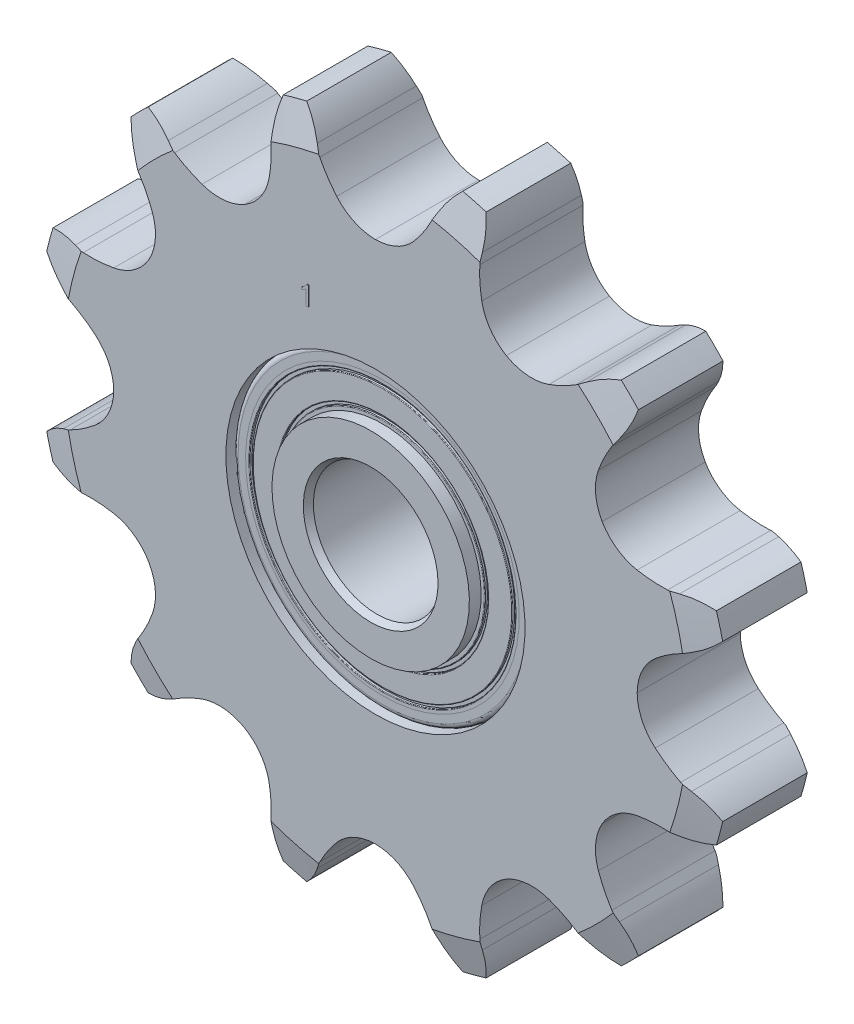
from build123d import *

# Parameters (mm, degrees)
SKETCH3_W               = 16.2
SKETCH3_H               = 31
CUT_EXTRUDE1_DEPTH      = 78.499096769
CIRPATTERN1_COUNT       = 12
SKETCH5_OUTSIDE_W       = 719.348
SKETCH5_OUTSIDE_H       = 719.348
SKETCH5_OUTSIDE_R       = 49.069031975
CUT_EXTRUDE2_DEPTH      = 77.828852413
CUT_EXTRUDE2_DRAFT      = -75
MIRROR1_COPY_1_SKETCH_W = 719.348
MIRROR1_COPY_1_SKETCH_H = 719.348
MIRROR1_COPY_1_SKETCH_R = 49.069031975
MIRROR1_COPY_1_DEPTH    = 77.828852413
MIRROR1_COPY_1_DRAFT    = -75
CIRPATTERN2_COUNT       = 13
BOSS_EXTRUDE1_START     = 8.1
BOSS_EXTRUDE1_DEPTH     = 0.05


# Read off the part's stored shape, not the designer's step: Boss-Extrude1
with BuildPart() as part:
    # Sketch3 → Revolve1 (revolve)
    with BuildSketch(Plane(origin=(0, 0, 0), x_dir=(0, 0, -1), z_dir=(1, 0, 0)), mode=Mode.PRIVATE) as revolve1_sk:
        with Locations((0, 39)):
            Rectangle(SKETCH3_W, SKETCH3_H)
    revolve(revolve1_sk.sketch.rotate(Axis((0, 0, 8.85), (0, 0, -1)), 180), axis=Axis((0, 0, 8.85), (0, 0, -1)))

    # Sketch4 → Cut-Extrude1 (cut, symmetric)
    with BuildSketch(Plane.XY):
        with BuildLine():
            Line((16.395309767, 45.903792094), (16.486362071, 47.467099789))
            ThreePointArc((16.486362071, 47.467099789), (16.150189907, 51.335451092), (14.72288018, 54.946536867))
            ThreePointArc((14.72288018, 54.946536867), (30.659278644, 53.103428334), (40.223656687, 40.223656687))
            ThreePointArc((40.223656687, 40.223656687), (36.382709807, 39.654200281), (32.864533225, 38.011158264))
            Line((32.864533225, 38.011158264), (31.5561952, 37.150650808))
            ThreePointArc((31.5561952, 37.150650808), (29.4658529, 35.964450667), (27.252026776, 35.028728702))
            ThreePointArc((27.252026776, 35.028728702), (23.843142089, 34.592588408), (20.561780988, 35.614049365))
            ThreePointArc((20.561780988, 35.614049365), (18.0364893, 37.945060959), (16.70975553, 41.115311844))
            ThreePointArc((16.70975553, 41.115311844), (16.41320146, 43.500402489), (16.395309767, 45.903792094))
        make_face()
    cut_extrude1 = extrude(amount=CUT_EXTRUDE1_DEPTH, both=True, mode=Mode.SUBTRACT)

    # CirPattern1: Cut-Extrude1 ×12 about axis
    cirpattern1_axis = Axis((0, 0, 0), (0, 0, 1))
    for i in range(1, CIRPATTERN1_COUNT):
        add(cut_extrude1.rotate(cirpattern1_axis, i * 360 / CIRPATTERN1_COUNT), mode=Mode.SUBTRACT)


with BuildPart() as cut_extrude2_tool:
    # Sketch5 outside → Cut-Extrude2 (with draft: the straight prism first)
    with BuildSketch(Plane.XY.offset(8.1)):
        Rectangle(SKETCH5_OUTSIDE_W, SKETCH5_OUTSIDE_H)
        Circle(SKETCH5_OUTSIDE_R, mode=Mode.SUBTRACT)
    extrude(amount=-CUT_EXTRUDE2_DEPTH)
    # Cut-Extrude2: the draft: its side faces are tilted about the plane it starts from
    cut_extrude2_sides = [cut_extrude2_tool.faces().sort_by_distance(p)[0] for p in [
        (0, -359.674, -30.814426207),
        (359.674, 0, -30.814426207),
        (0, 359.674, -30.814426207),
        (-359.674, 0, -30.814426207),
        (-49.069031975, 0, -30.814426207),
    ]]
    draft(cut_extrude2_sides, Plane.XY.offset(8.1), CUT_EXTRUDE2_DRAFT)


with BuildPart() as part_1:
    add(part.part)

    # Cut-Extrude2: cut by cut_extrude2_tool
    add(cut_extrude2_tool.part, mode=Mode.SUBTRACT)


with BuildPart() as mirror1_copy_1_tool:
    # Mirror1 copy 1 sketch → Mirror1 copy 1 (with draft: the straight prism first)
    with BuildSketch(Plane(origin=(0, 0, -8.1), x_dir=(1, 0, 0), z_dir=(0, 0, -1))):
        Rectangle(MIRROR1_COPY_1_SKETCH_W, MIRROR1_COPY_1_SKETCH_H)
        Circle(MIRROR1_COPY_1_SKETCH_R, mode=Mode.SUBTRACT)
    extrude(amount=-MIRROR1_COPY_1_DEPTH)
    # Mirror1 copy 1: the draft: its side faces are tilted about the plane it starts from
    mirror1_copy_1_sides = [mirror1_copy_1_tool.faces().sort_by_distance(p)[0] for p in [
        (0, -359.674, 30.814426207),
        (359.674, 0, 30.814426207),
        (0, 359.674, 30.814426207),
        (-359.674, 0, 30.814426207),
        (-49.069031975, 0, 30.814426207),
    ]]
    draft(mirror1_copy_1_sides, Plane(origin=(0, 0, -8.1), x_dir=(1, 0, 0), z_dir=(0, 0, -1)), MIRROR1_COPY_1_DRAFT)


with BuildPart() as part_2:
    add(part_1.part)

    # Mirror1 copy 1: cut by mirror1_copy_1_tool
    add(mirror1_copy_1_tool.part, mode=Mode.SUBTRACT)


with BuildPart() as body_2:
    # Sketch6 → Revolve2 (revolve)
    with BuildSketch(Plane(origin=(0, 0, 0), x_dir=(0, 0, -1), z_dir=(1, 0, 0)), mode=Mode.PRIVATE) as revolve2_sk:
        Polygon((-8.85, 10.577350269), (-7.85, 10), (7.85, 10), (8.85, 10.577350269), (8.85, 15.51), (-8.85, 15.51), align=None)
    revolve(revolve2_sk.sketch.rotate(Axis((0, 0, 8.85), (0, 0, -1)), 180), axis=Axis((0, 0, 8.85), (0, 0, -1)))


with BuildPart() as body_3:
    # Sketch7 → Revolve3 (revolve)
    with BuildSketch(Plane(origin=(0, 0, 0), x_dir=(0, 0, -1), z_dir=(1, 0, 0)), mode=Mode.PRIVATE) as revolve3_sk:
        with BuildLine():
            Line((7, 21.5025), (-7, 21.5025))
            Line((-7, 21.5025), (-7, 22.692835578))
            ThreePointArc((-7, 22.692835578), (-6.763587014, 23.263587014), (-6.192835578, 23.5))
            Line((-6.192835578, 23.5), (6.192835578, 23.5))
            ThreePointArc((6.192835578, 23.5), (6.763587014, 23.263587014), (7, 22.692835578))
            Line((7, 22.692835578), (7, 21.5025))
        make_face()
    revolve(revolve3_sk.sketch.rotate(Axis((0, 0, 8.85), (0, 0, -1)), 180), axis=Axis((0, 0, 8.85), (0, 0, -1)))


with BuildPart() as body_4:
    # Sketch8 → Revolve4 (revolve)
    with BuildSketch(Plane(origin=(0, 0, 0), x_dir=(0, 0, -1), z_dir=(1, 0, 0))):
        with BuildLine():
            Line((-2.99625, 18.50625), (2.99625, 18.50625))
            ThreePointArc((2.99625, 18.50625), (0, 21.5025), (-2.99625, 18.50625))
        make_face()
    revolve(axis=Axis((0, 18.50625, 2.99625), (0, 0, -1)))


with BuildPart() as cirpattern2_1:
    # CirPattern2: pattern copy
    add(body_4.part.rotate(Axis((0, 0, 0), (0, 0, 1)), 1 * 360 / CIRPATTERN2_COUNT))


with BuildPart() as cirpattern2_2:
    # CirPattern2: pattern copy
    add(body_4.part.rotate(Axis((0, 0, 0), (0, 0, 1)), 2 * 360 / CIRPATTERN2_COUNT))


with BuildPart() as cirpattern2_3:
    # CirPattern2: pattern copy
    add(body_4.part.rotate(Axis((0, 0, 0), (0, 0, 1)), 3 * 360 / CIRPATTERN2_COUNT))


with BuildPart() as cirpattern2_4:
    # CirPattern2: pattern copy
    add(body_4.part.rotate(Axis((0, 0, 0), (0, 0, 1)), 4 * 360 / CIRPATTERN2_COUNT))


with BuildPart() as cirpattern2_5:
    # CirPattern2: pattern copy
    add(body_4.part.rotate(Axis((0, 0, 0), (0, 0, 1)), 5 * 360 / CIRPATTERN2_COUNT))


with BuildPart() as cirpattern2_6:
    # CirPattern2: pattern copy
    add(body_4.part.rotate(Axis((0, 0, 0), (0, 0, 1)), 6 * 360 / CIRPATTERN2_COUNT))


with BuildPart() as cirpattern2_7:
    # CirPattern2: pattern copy
    add(body_4.part.rotate(Axis((0, 0, 0), (0, 0, 1)), 7 * 360 / CIRPATTERN2_COUNT))


with BuildPart() as cirpattern2_8:
    # CirPattern2: pattern copy
    add(body_4.part.rotate(Axis((0, 0, 0), (0, 0, 1)), 8 * 360 / CIRPATTERN2_COUNT))


with BuildPart() as cirpattern2_9:
    # CirPattern2: pattern copy
    add(body_4.part.rotate(Axis((0, 0, 0), (0, 0, 1)), 9 * 360 / CIRPATTERN2_COUNT))


with BuildPart() as cirpattern2_10:
    # CirPattern2: pattern copy
    add(body_4.part.rotate(Axis((0, 0, 0), (0, 0, 1)), 10 * 360 / CIRPATTERN2_COUNT))


with BuildPart() as cirpattern2_11:
    # CirPattern2: pattern copy
    add(body_4.part.rotate(Axis((0, 0, 0), (0, 0, 1)), 11 * 360 / CIRPATTERN2_COUNT))


with BuildPart() as cirpattern2_12:
    # CirPattern2: pattern copy
    add(body_4.part.rotate(Axis((0, 0, 0), (0, 0, 1)), 12 * 360 / CIRPATTERN2_COUNT))


with BuildPart() as body_17:
    # Sketch9 → Revolve5 (revolve)
    with BuildSketch(Plane(origin=(0, 0, 0), x_dir=(0, 0, -1), z_dir=(1, 0, 0)), mode=Mode.PRIVATE) as revolve5_sk:
        with BuildLine():
            Line((-7, 21.5025), (-7, 21.00325))
            ThreePointArc((-7, 21.00325), (-6.970710678, 20.932539322), (-6.9, 20.90325))
            Line((-6.9, 20.90325), (-6.6, 20.90325))
            Line((-6.6, 20.90325), (-6.6, 20.404))
            Line((-6.6, 20.404), (-6.9, 20.404))
            ThreePointArc((-6.9, 20.404), (-6.970710678, 20.374710678), (-7, 20.304))
            Line((-7, 20.304), (-7, 16.7085))
            ThreePointArc((-7, 16.7085), (-6.970710678, 16.637789322), (-6.9, 16.6085))
            Line((-6.9, 16.6085), (-6.6, 16.6085))
            Line((-6.6, 16.6085), (-6.6, 16.10925))
            Line((-6.6, 16.10925), (-6.9, 16.10925))
            ThreePointArc((-6.9, 16.10925), (-6.970710678, 16.079960678), (-7, 16.00925))
            Line((-7, 16.00925), (-7, 15.51))
            Line((-7, 15.51), (-2.99625, 15.51))
            Line((-2.99625, 15.51), (-2.99625, 21.5025))
            Line((-2.99625, 21.5025), (-7, 21.5025))
        make_face()
        with BuildLine():
            Line((2.99625, 21.5025), (7, 21.5025))
            Line((7, 21.5025), (7, 21.00325))
            ThreePointArc((7, 21.00325), (6.970710678, 20.932539322), (6.9, 20.90325))
            Line((6.9, 20.90325), (6.6, 20.90325))
            Line((6.6, 20.90325), (6.6, 20.404))
            Line((6.6, 20.404), (6.9, 20.404))
            ThreePointArc((6.9, 20.404), (6.970710678, 20.374710678), (7, 20.304))
            Line((7, 20.304), (7, 16.7085))
            ThreePointArc((7, 16.7085), (6.970710678, 16.637789322), (6.9, 16.6085))
            Line((6.9, 16.6085), (6.6, 16.6085))
            Line((6.6, 16.6085), (6.6, 16.10925))
            Line((6.6, 16.10925), (6.9, 16.10925))
            ThreePointArc((6.9, 16.10925), (6.970710678, 16.079960678), (7, 16.00925))
            Line((7, 16.00925), (7, 15.51))
            Line((7, 15.51), (2.99625, 15.51))
            Line((2.99625, 15.51), (2.99625, 21.5025))
        make_face()
    revolve(revolve5_sk.sketch.rotate(Axis((0, 0, 8.85), (0, 0, -1)), 180), axis=Axis((0, 0, 8.85), (0, 0, -1)))


with BuildPart() as body_18:
    # Boss-Extrude1 outline → Boss-Extrude1 (new body)
    with BuildSketch(Plane.XY.offset(BOSS_EXTRUDE1_START)):
        with BuildLine():
            add(Edge.make_bspline(
                [(-11.538461538, 28.94375), (-11.490400336, 28.968501616), (-11.395674551, 29.017285584), (-11.261847501, 29.101542204), (-11.136905554, 29.192879849), (-11.022916994, 29.291278296), (-10.920733513, 29.391859173), (-10.834622009, 29.493349229), (-10.762569383, 29.592028276), (-10.726419216, 29.660845967), (-10.709134615, 29.69375)],
                knots=[0, 0, 0, 0, 0.142657251, 0.281168994, 0.416977192, 0.550852493, 0.67836417, 0.795032443, 0.901998178, 1, 1, 1, 1], degree=3))
            Line((-11.538461538, 28.94375), (-11.538461538, 28.589182692))
            add(Edge.make_bspline(
                [(-10.846153846, 29.031490385), (-10.868300034, 29.010133111), (-10.914328459, 28.965744359), (-10.992134648, 28.90292319), (-11.078976298, 28.839251272), (-11.173725716, 28.778023605), (-11.270306719, 28.720384359), (-11.363639824, 28.668546719), (-11.452166795, 28.624679498), (-11.510479989, 28.600692729), (-11.538461538, 28.589182692)],
                knots=[0, 0, 0, 0, 0.1116703, 0.232094481, 0.362743459, 0.50255751, 0.641525103, 0.771098495, 0.890161757, 1, 1, 1, 1], degree=3))
            Line((-10.846153846, 29.031490385), (-10.846153846, 26.69375))
            Line((-10.846153846, 26.69375), (-10.461538462, 26.69375))
            Line((-10.461538462, 26.69375), (-10.461538462, 29.69375))
            Line((-10.461538462, 29.69375), (-10.709134615, 29.69375))
        make_face()
    extrude(amount=BOSS_EXTRUDE1_DEPTH)


solid = Compound([part_2.part, body_2.part, body_3.part, body_4.part, cirpattern2_1.part, cirpattern2_2.part, cirpattern2_3.part, cirpattern2_4.part, cirpattern2_5.part, cirpattern2_6.part, cirpattern2_7.part, cirpattern2_8.part, cirpattern2_9.part, cirpattern2_10.part, cirpattern2_11.part, cirpattern2_12.part, body_17.part, body_18.part])
